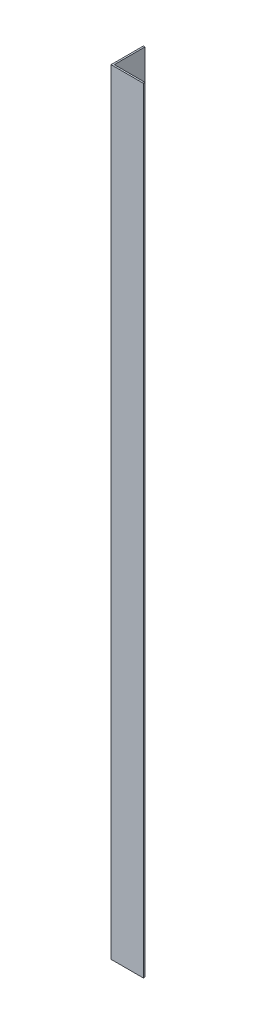
from build123d import *

# Parameters (mm, degrees)
EXTRUDE_1_DEPTH = 360


with BuildPart() as part:
    # Эскиз1 → Бобышка-Вытянуть1 (new body)
    with BuildSketch(Plane(origin=(0, 0, 0), x_dir=(1, 0, 0), z_dir=(0, 1, 0))):
        Polygon((0, 0), (0, 15), (0.75, 15), (0.75, 0.75), (15, 0.75), (15, 0), align=None)
    extrude(amount=EXTRUDE_1_DEPTH)


solid = part.part
